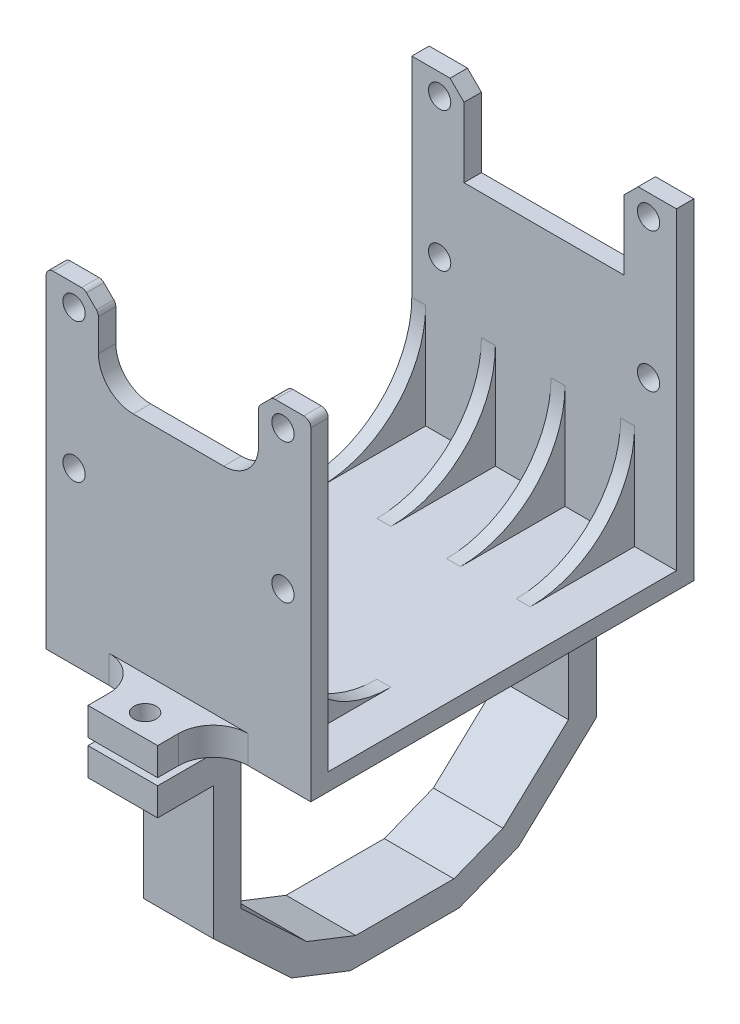
from build123d import *

# Parameters (mm, degrees)
SKETCH_1_W           = 38
SKETCH_1_H           = 45
SKETCH_1_R           = 1.6
EXTRUDE_1_DEPTH      = 2.5
CUT_EXTRUDE_1_DEPTH  = 2.5
SKETCH_3_W           = 38
SKETCH_3_H           = 55
EXTRUDE_2_DEPTH      = 2.5
FILLET_3_R           = 1
FILLET1_R            = 5
EXTRUDE3_DEPTH       = 2
LPATTERN1_COUNT      = 4
LPATTERN1_PITCH      = 10
MIRROR3_COPY_1_DEPTH = 2
MIRROR3_COPY_2_DEPTH = 2
MIRROR3_COPY_3_DEPTH = 2
MIRROR3_COPY_4_DEPTH = 2
EXTRUDE4_DEPTH       = 5
EXTRUDE4_DEPTH_BACK  = 5
SKETCH5_W            = 8
SKETCH5_H            = 4
SKETCH6_R            = 1.6
CUT_EXTRUDE1_DEPTH   = 20
FILLET2_R            = 5
FILLET3_R            = 5


with BuildPart() as part:
    # 草图1 → 凸台-拉伸1 (new body)
    with BuildSketch(Plane.XY):
        with Locations((-0.320113314, 1.635589826)):
            Rectangle(SKETCH_1_W, SKETCH_1_H)
        with Locations((-15.320113314, 21.135589826)):
            Circle(SKETCH_1_R, mode=Mode.SUBTRACT)
        with Locations((14.679886686, 21.135589826)):
            Circle(SKETCH_1_R, mode=Mode.SUBTRACT)
        with Locations((-15.320113314, 1.135589826)):
            Circle(SKETCH_1_R, mode=Mode.SUBTRACT)
        with Locations((14.679886686, 1.135589826)):
            Circle(SKETCH_1_R, mode=Mode.SUBTRACT)
    extrude_1 = extrude(amount=EXTRUDE_1_DEPTH)

    # 草图2 → 切除-拉伸1 (cut)
    with BuildSketch(Plane.XY.offset(2.5)):
        Polygon((-11.820113314, 24.135589826), (11.179886686, 24.135589826), (13.179886686, 24.135589826), (11.179886686, 22.135589826), (11.179886686, 12.135589826), (-11.820113314, 12.135589826), (-11.820113314, 22.135589826), (-13.820113314, 24.135589826), align=None)
    cut_extrude_1 = extrude(amount=-CUT_EXTRUDE_1_DEPTH, mode=Mode.SUBTRACT)

    # 草图3 → 凸台-拉伸2 (add)
    with BuildSketch(Plane.XZ.offset(20.864410174)):
        with Locations((-0.320113314, -25)):
            Rectangle(SKETCH_3_W, SKETCH_3_H)
    extrude(amount=EXTRUDE_2_DEPTH)

    # 圆角3
    fillet_3_edges = [part.edges().sort_by_distance(p)[0] for p in [
        (11.179886686, 22.135589826, 1.25),
        (13.179886686, 24.135589826, 1.25),
        (-19.320113314, 24.135589826, 1.25),
        (18.679886686, 24.135589826, 1.25),
        (-11.820113314, 22.135589826, 1.25),
        (-13.820113314, 24.135589826, 1.25),
    ]]
    fillet(fillet_3_edges, radius=FILLET_3_R)

    # Fillet1
    fillet1_edges = [part.edges().sort_by_distance(p)[0] for p in [
        (-11.820113314, 12.135589826, 1.25),
        (11.179886686, 12.135589826, 1.25),
    ]]
    fillet(fillet1_edges, radius=FILLET1_R)

    # Sketch4 → Extrude3 (add)
    with BuildSketch(Plane.ZY.offset(19.320113314)):
        with BuildLine():
            Line((0, -5.864410174), (0, -20.864410174))
            Line((0, -20.864410174), (-15, -20.864410174))
            ThreePointArc((-15, -20.864410174), (-4.393398282, -16.471011892), (0, -5.864410174))
        make_face()
    extrude3 = extrude(amount=-EXTRUDE3_DEPTH)

    # Mirror1: 凸台-拉伸1 across plane
    add(extrude_1.mirror(Plane(origin=(0, 0, -25), x_dir=(1, 0, 0), z_dir=(0, 0, -1))))

    # Mirror2: 切除-拉伸1 across plane
    add(cut_extrude_1.mirror(Plane(origin=(0, 0, -25), x_dir=(1, 0, 0), z_dir=(0, 0, -1))), mode=Mode.SUBTRACT)

    # LPattern1: Extrude3 ×4
    with Locations(*[(i * LPATTERN1_PITCH, 0, 0) for i in range(1, LPATTERN1_COUNT)]):
        add(extrude3)

    # Mirror3 copy 1 sketch → Mirror3 copy 1 (add)
    with BuildSketch(Plane(origin=(-9.320113314, 0, -50), x_dir=(0, 0, -1), z_dir=(-1, 0, 0))):
        with BuildLine():
            Line((0, 5.864410174), (0, 20.864410174))
            Line((0, 20.864410174), (-15, 20.864410174))
            ThreePointArc((-15, 20.864410174), (-4.393398282, 16.471011892), (0, 5.864410174))
        make_face()
    extrude(amount=-MIRROR3_COPY_1_DEPTH)

    # Mirror3 copy 2 sketch → Mirror3 copy 2 (add)
    with BuildSketch(Plane(origin=(0.679886686, 0, -50), x_dir=(0, 0, -1), z_dir=(-1, 0, 0))):
        with BuildLine():
            Line((0, 5.864410174), (0, 20.864410174))
            Line((0, 20.864410174), (-15, 20.864410174))
            ThreePointArc((-15, 20.864410174), (-4.393398282, 16.471011892), (0, 5.864410174))
        make_face()
    extrude(amount=-MIRROR3_COPY_2_DEPTH)

    # Mirror3 copy 3 sketch → Mirror3 copy 3 (add)
    with BuildSketch(Plane(origin=(10.679886686, 0, -50), x_dir=(0, 0, -1), z_dir=(-1, 0, 0))):
        with BuildLine():
            Line((0, 5.864410174), (0, 20.864410174))
            Line((0, 20.864410174), (-15, 20.864410174))
            ThreePointArc((-15, 20.864410174), (-4.393398282, 16.471011892), (0, 5.864410174))
        make_face()
    extrude(amount=-MIRROR3_COPY_3_DEPTH)

    # Mirror3 copy 4 sketch → Mirror3 copy 4 (add)
    with BuildSketch(Plane(origin=(-19.320113314, 0, -50), x_dir=(0, 0, -1), z_dir=(-1, 0, 0))):
        with BuildLine():
            Line((0, 5.864410174), (0, 20.864410174))
            Line((0, 20.864410174), (-15, 20.864410174))
            ThreePointArc((-15, 20.864410174), (-4.393398282, 16.471011892), (0, 5.864410174))
        make_face()
    extrude(amount=-MIRROR3_COPY_4_DEPTH)

    # Sketch5 → Extrude4 (add, two sides: drawn at the far end of the back side and taken through both)
    with BuildSketch(Plane.ZY.offset(0.320113314).offset(-EXTRUDE4_DEPTH_BACK)):
        Polygon((-48.5, -23.364410174), (-48.5, -45.648790241), (-39.095261683, -54.441591814), (-32.049269501, -57.2068117), (-17.950730499, -57.2068117), (-10.904738317, -54.441591814), (-1.5, -45.648790241), (-1.5, -24.364410174), (10.5, -24.364410174), (10.5, -28.364410174), (2.5, -28.364410174), (2.5, -47.384968523), (-8.731572968, -57.885738362), (-17.193922344, -61.2068117), (-32.806077656, -61.2068117), (-41.268427032, -57.885738362), (-52.5, -47.384968523), (-52.5, -23.364410174), align=None)
        with Locations((6.5, -21.364410174)):
            Rectangle(SKETCH5_W, SKETCH5_H)
    extrude(amount=EXTRUDE4_DEPTH + EXTRUDE4_DEPTH_BACK)

    # Sketch6 → Cut-Extrude1 (cut)
    with BuildSketch(Plane.XZ.offset(28.364410174)):
        with Locations((-0.320113314, 7.3)):
            Circle(SKETCH6_R)
    extrude(amount=-CUT_EXTRUDE1_DEPTH, mode=Mode.SUBTRACT)

    # Fillet2
    fillet2_edges = [part.edges().sort_by_distance(p)[0] for p in [
        (4.679886686, -23.364410174, -50.5),
        (-5.320113314, -23.364410174, -50.5),
    ]]
    fillet(fillet2_edges, radius=FILLET2_R)

    # Fillet3
    fillet3_edges = [part.edges().sort_by_distance(p)[0] for p in [
        (4.679886686, -21.364410174, 2.5),
        (-5.320113314, -21.364410174, 2.5),
    ]]
    fillet(fillet3_edges, radius=FILLET3_R)


solid = part.part
